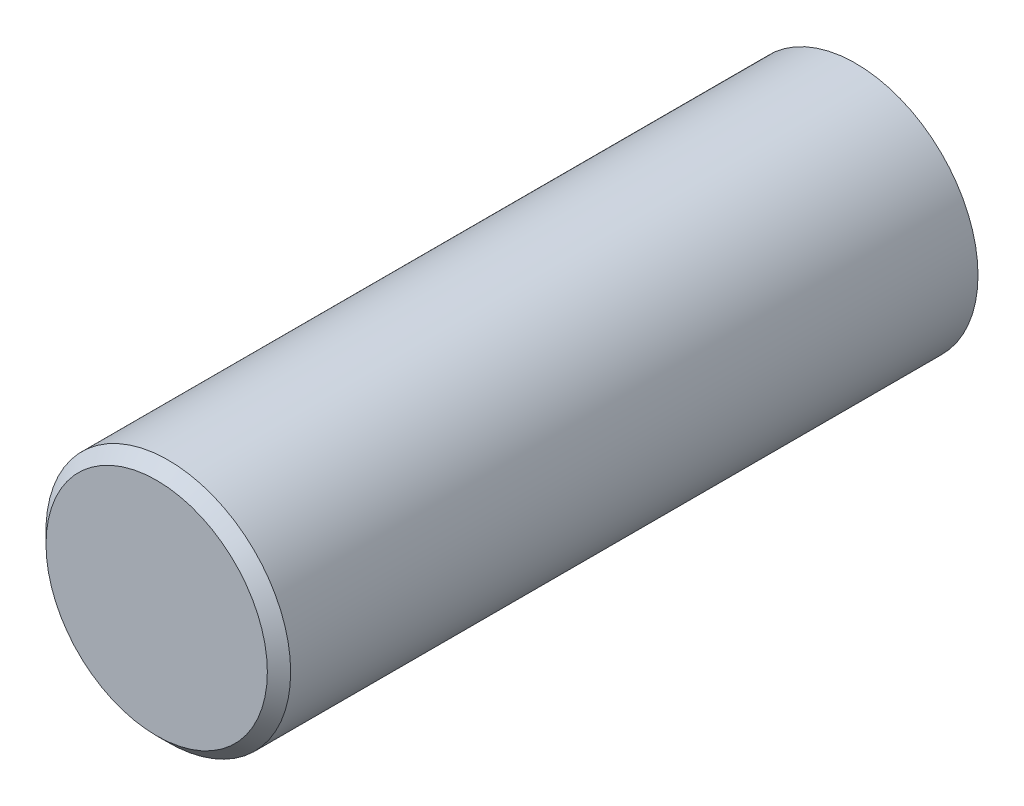
from build123d import *

# Parameters (mm, degrees)
ESQUISSE1_R        = 5.25
BOSS_EXTRU_1_DEPTH = 30
CHANFREIN1_SIZE    = 0.5


with BuildPart() as part:
    # Esquisse1 → Boss.-Extru.1 (new body)
    with BuildSketch(Plane.XY):
        Circle(ESQUISSE1_R)
    extrude(amount=BOSS_EXTRU_1_DEPTH)

    # Chanfrein1
    chanfrein1_edges = [part.edges().sort_by_distance(p)[0] for p in [
        (-5.25, 0, 30),
    ]]
    chamfer(chanfrein1_edges, length=CHANFREIN1_SIZE)


solid = part.part
